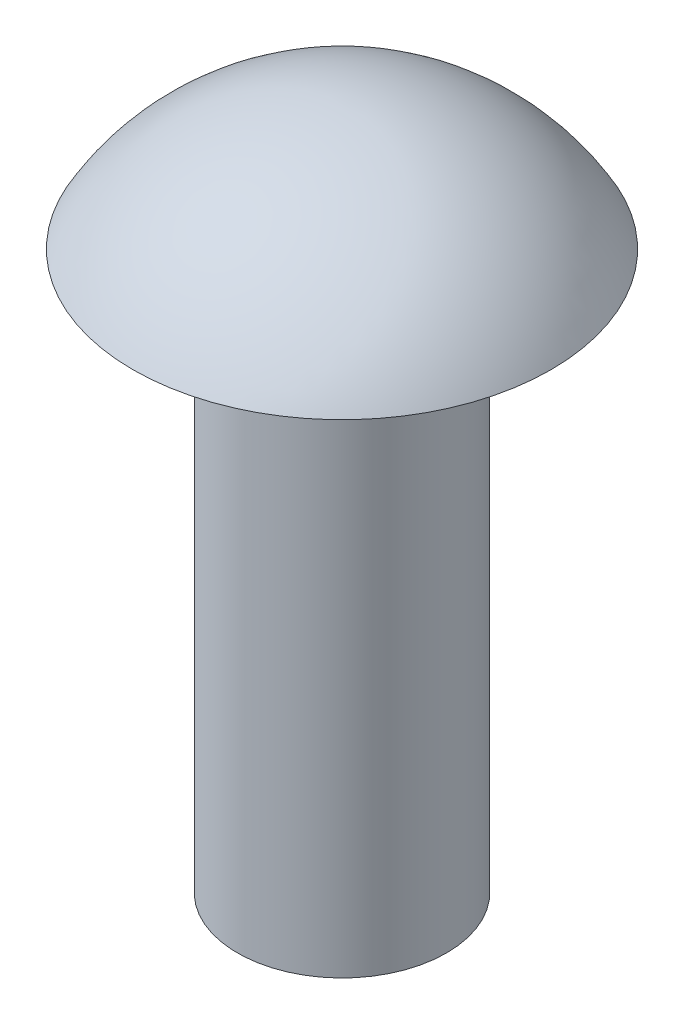
from build123d import *

# Parameters (mm, degrees)
SKETCH2_R           = 1.5
BOSS_EXTRUDE1_DEPTH = 8


with BuildPart() as part:
    # Sketch1 → Revolve1 (revolve)
    with BuildSketch(Plane.XY):
        with BuildLine():
            Line((0, 0), (0, 1.75))
            ThreePointArc((0, 1.75), (1.736555499, 1.280523712), (3, 0))
            Line((3, 0), (0, 0))
        make_face()
    revolve(axis=Axis((0, -1000, 0), (0, 1, 0)))

    # Sketch2 → Boss-Extrude1 (add)
    with BuildSketch(Plane.XZ):
        Circle(SKETCH2_R)
    extrude(amount=BOSS_EXTRUDE1_DEPTH)


solid = part.part
